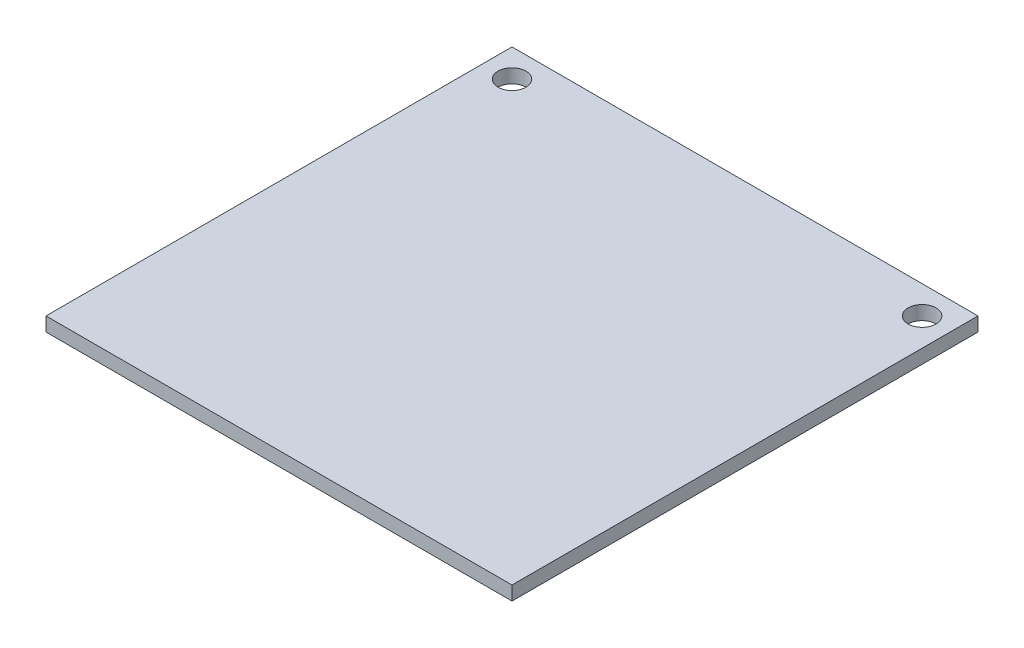
from build123d import *

# Parameters (mm, degrees)
SKETCH1_W           = 50
SKETCH1_H           = 50
SKETCH1_R           = 1.5
BOSS_EXTRUDE1_DEPTH = 1.5


with BuildPart() as part:
    # Sketch1 → Boss-Extrude1 (new body)
    with BuildSketch(Plane(origin=(0, 0, 0), x_dir=(1, 0, 0), z_dir=(0, 1, 0))):
        with Locations((25, 25)):
            Rectangle(SKETCH1_W, SKETCH1_H)
        with Locations((47, 47)):
            Circle(SKETCH1_R, mode=Mode.SUBTRACT)
        with Locations((3, 47)):
            Circle(SKETCH1_R, mode=Mode.SUBTRACT)
    extrude(amount=BOSS_EXTRUDE1_DEPTH)


solid = part.part
